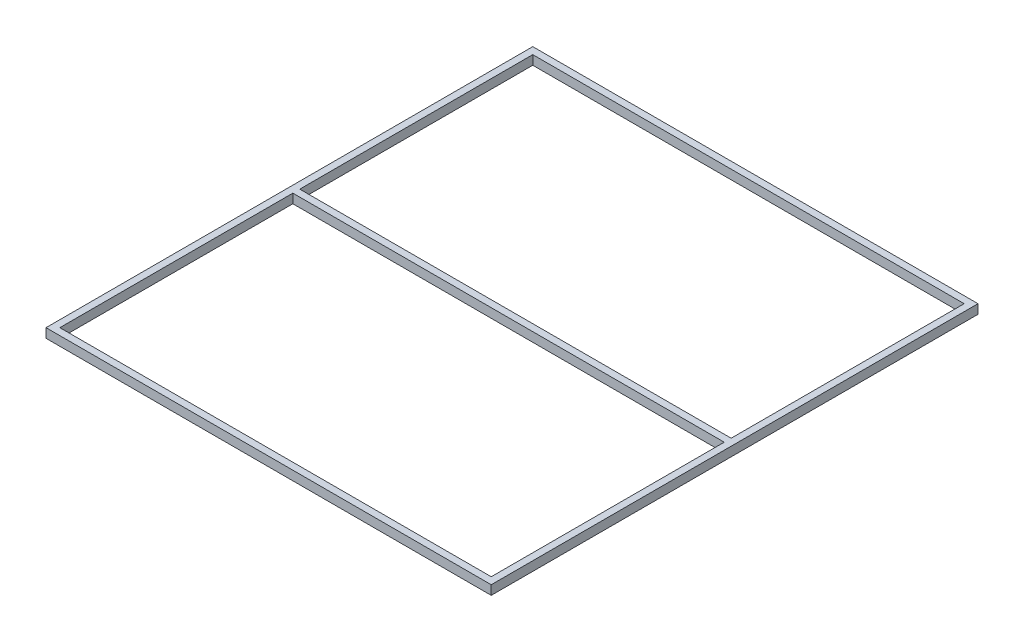
from build123d import *

# Parameters (mm, degrees)
METAL_FRAME_W       = 7720
METAL_FRAME_H       = 4220
METAL_FRAME_W_2     = 7600
METAL_FRAME_H_2     = 2020
METALFRAME_DEPTH    = 80
SKETCH18_W          = 4667.943298929
SKETCH18_H          = 6508.190176391
CUT_EXTRUDE1_DEPTH  = 8718.086669295
SKETCH19_W          = 60
SKETCH19_H          = 4100
BOSS_EXTRUDE1_DEPTH = 80


with BuildPart() as part:
    # Metal frame → MetalFrame (new body)
    with BuildSketch(Plane(origin=(0, 0, 0), x_dir=(1, 0, 0), z_dir=(0, 1, 0))):
        with Locations((3800, 2050)):
            Rectangle(METAL_FRAME_W, METAL_FRAME_H)
        with Locations((3800, 1010)):
            Rectangle(METAL_FRAME_W_2, METAL_FRAME_H_2, mode=Mode.SUBTRACT)
        with Locations((3800, 3090)):
            Rectangle(METAL_FRAME_W_2, METAL_FRAME_H_2, mode=Mode.SUBTRACT)
    extrude(amount=-METALFRAME_DEPTH)

    # Sketch18 → Cut-Extrude1 (cut, through all)
    with BuildSketch(Plane(origin=(0, 0, 0), x_dir=(1, 0, 0), z_dir=(0, 1, 0))):
        with Locations((6133.971649464, 2239.218210402)):
            Rectangle(SKETCH18_W, SKETCH18_H)
    extrude(amount=-CUT_EXTRUDE1_DEPTH, mode=Mode.SUBTRACT)

    # Sketch19 → Boss-Extrude1 (add)
    with BuildSketch(Plane(origin=(0, 0, 0), x_dir=(1, 0, 0), z_dir=(0, 1, 0))):
        with Locations((3770, 2050)):
            Rectangle(SKETCH19_W, SKETCH19_H)
    extrude(amount=-BOSS_EXTRUDE1_DEPTH)


solid = part.part
